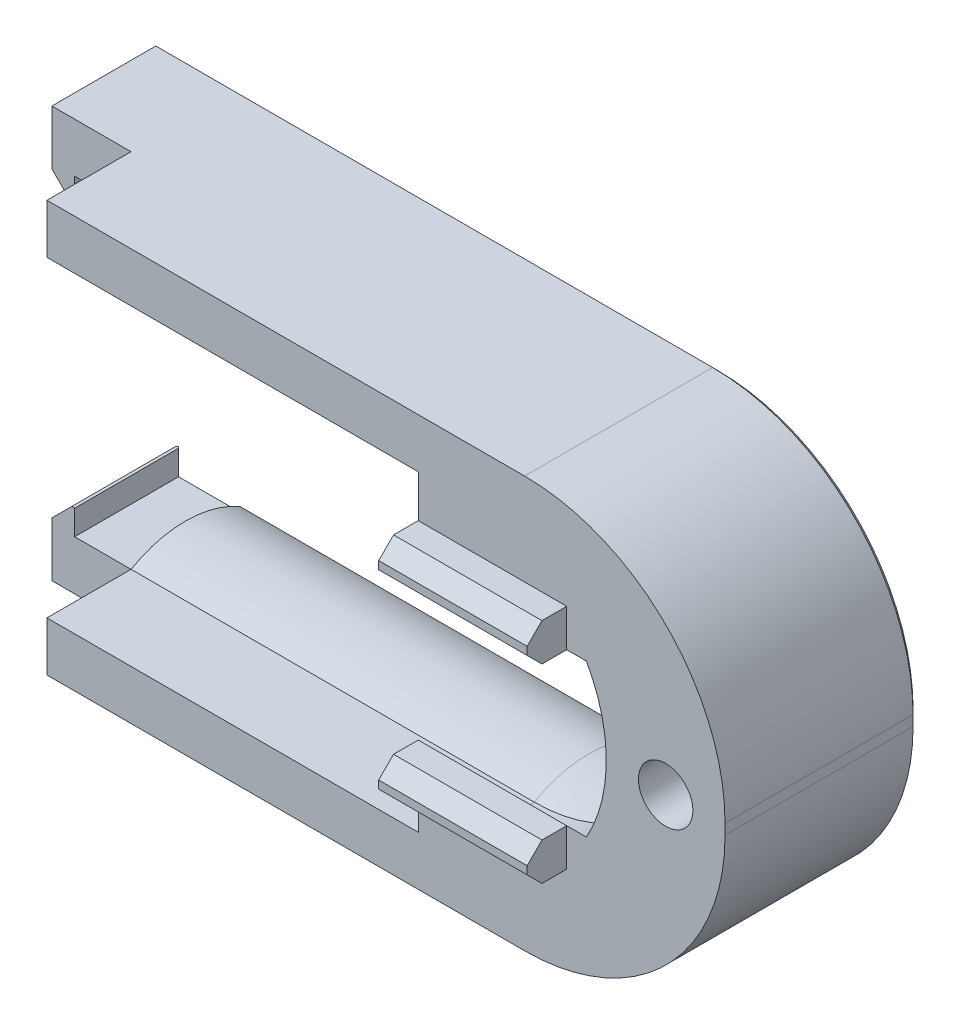
from build123d import *

# Parameters (mm, degrees)
BOSS_EXTRUDE1_DEPTH                                 = 14
BOSS_EXTRUDE1_DEPTH_BACK                            = 5.5
SKETCH3_R                                           = 2.750000000000022
BOSS_EXTRUDE2_DEPTH                                 = 7
CBORE_FOR_M5_HEX_SOCKET_HEAD_CAP_SCREW2_D           = 5.5
CBORE_FOR_M5_HEX_SOCKET_HEAD_CAP_SCREW2_CBORE_D     = 10
CBORE_FOR_M5_HEX_SOCKET_HEAD_CAP_SCREW2_CBORE_DEPTH = 5.4
SKETCH11_W                                          = 15
SKETCH11_H                                          = 3.8000000000000007
BOSS_EXTRUDE3_DEPTH                                 = 4
CHAMFER1_SIZE                                       = 1.5
CUT_EXTRUDE1_DEPTH                                  = 7
SKETCH13_W                                          = 15
SKETCH13_H                                          = 15.400000000000002
CUT_EXTRUDE2_DEPTH                                  = 7
CUT_EXTRUDE3_DEPTH                                  = 7
SKETCH15_W                                          = 11
SKETCH15_H                                          = 5
BOSS_EXTRUDE4_DEPTH                                 = 8
SKETCH16_W                                          = 2.3
SKETCH16_H                                          = 2.5
BOSS_EXTRUDE5_DEPTH                                 = 11
CHAMFER4_SIZE                                       = 2
CHAMFER3_SIZE                                       = 0.5
CHAMFER5_SIZE                                       = 7


# Some blends are built 0.0001 mm under size
with BuildPart() as part:
    # Sweep1: sweep along a path in Sketch1
    with BuildLine(Plane.XY) as sweep1_path:
        Line((0, 0), (40.75, 0))
        ThreePointArc((40.75, 0), (55.05, 14.3), (40.75, 28.6))
        Line((40.75, 28.6), (0, 28.599999999999998))
    # Sketch2 → Sweep1 (sweep)
    with BuildSketch(Plane(origin=(0, 0, 0), x_dir=(0, 0, -1), z_dir=(1, 0, 0))):
        with BuildLine():
            Line((-5.500000000000001, -1.4737205583711734), (5.499999999999999, -1.4737205583711734))
            ThreePointArc((5.499999999999999, -1.4737205583711734), (-1.9e-16, 1.78e-15), (-5.500000000000001, -1.4737205583711734))
        make_face()
    sweep(path=sweep1_path.line)

    # Sketch3 → Boss-Extrude1 (add, two sides: drawn at the far end of the back side and taken through both)
    with BuildSketch(Plane.XY.offset(-BOSS_EXTRUDE1_DEPTH_BACK)):
        with BuildLine():
            Line((-7e-17, 30.07372055837117), (0, 35.07372055837117))
            Line((0, 35.07372055837117), (48.273720558371174, 35.07372055837117))
            ThreePointArc((48.273720558371174, 35.07372055837117), (62.59263287739877, 29.14263287739876), (68.52372055837118, 14.82372055837117))
            Line((68.52372055837118, 14.82372055837117), (68.52372055837118, 13.776279441628832))
            ThreePointArc((68.52372055837118, 13.776279441628832), (62.59263287739876, -0.5426328773987557), (48.273720558371174, -6.473720558371171))
            Line((48.273720558371174, -6.473720558371171), (0, -6.473720558371174))
            Line((0, -6.473720558371174), (0, -1.4737205583711734))
            Line((0, -1.4737205583711734), (40.75, -1.4737205583711734))
            ThreePointArc((40.75, -1.4737205583711734), (56.523720558371174, 14.3), (40.75, 30.073720558371175))
            Line((40.75, 30.073720558371175), (-7e-17, 30.07372055837117))
        make_face()
        with Locations((62.52372055837116, 14.299999999999999)):
            Circle(SKETCH3_R, mode=Mode.SUBTRACT)
    extrude(amount=BOSS_EXTRUDE1_DEPTH + BOSS_EXTRUDE1_DEPTH_BACK)

    # Sketch10 → Boss-Extrude2 (add)
    with BuildSketch(Plane.XY.offset(14)):
        Polygon((33.523720558371174, 30.07372055837117), (56.523720558371174, 30.07372055837117), (56.52372055837118, -1.473720558371177), (33.523720558371174, -1.4737205583711734), align=None)
    extrude(amount=-BOSS_EXTRUDE2_DEPTH)

    # CBORE for M5 Hex Socket Head Cap Screw2 (through all)
    with Locations(Plane(origin=(0, 0, -5.5), x_dir=(-1, 0, 0), z_dir=(0, 0, -1))):
        with Locations((-62.523720558, 14.3)):
            CounterBoreHole(CBORE_FOR_M5_HEX_SOCKET_HEAD_CAP_SCREW2_D / 2, CBORE_FOR_M5_HEX_SOCKET_HEAD_CAP_SCREW2_CBORE_D / 2, CBORE_FOR_M5_HEX_SOCKET_HEAD_CAP_SCREW2_CBORE_DEPTH)

    # Sketch11 → Boss-Extrude3 (add)
    with BuildSketch(Plane.XY.offset(14)):
        with Locations((45.02372055837117, 23.9)):
            Rectangle(SKETCH11_W, SKETCH11_H)
        Polygon((37.52372055837117, 6.599999999999998), (52.52372055837117, 6.599999999999998), (52.523720558371174, 2.799999999999997), (37.52372055837117, 2.799999999999997), align=None)
    extrude(amount=BOSS_EXTRUDE3_DEPTH)

    # Chamfer1
    chamfer1_edges = [part.edges().sort_by_distance(p)[0] for p in [
        (45.02372055837117, 22, 18),
        (45.02372055837117, 25.8, 18),
        (45.02372055837117, 2.799999999999997, 18),
        (45.02372055837117, 6.599999999999998, 18),
    ]]
    chamfer(chamfer1_edges, length=CHAMFER1_SIZE)

    # Sketch12 → Cut-Extrude1 (cut)
    with BuildSketch(Plane.XY.offset(14)):
        Polygon((33.523720558371174, 30.07372055837117), (37.52372055837117, 30.07372055837117), (37.52372055837118, -1.4737205583711734), (33.523720558371174, -1.4737205583711734), align=None)
    extrude(amount=-CUT_EXTRUDE1_DEPTH, mode=Mode.SUBTRACT)

    # Sketch13 → Cut-Extrude2 (cut)
    with BuildSketch(Plane.XY.offset(14)):
        with Locations((45.02372055837117, 14.299999999999999)):
            Rectangle(SKETCH13_W, SKETCH13_H)
    extrude(amount=-CUT_EXTRUDE2_DEPTH, mode=Mode.SUBTRACT)

    # Sketch14 → Cut-Extrude3 (cut)
    with BuildSketch(Plane(origin=(0, 0, 7), x_dir=(-1, 0, 0), z_dir=(0, 0, -1))):
        with BuildLine():
            Line((-52.52372055837117, 22), (-54.51663576381613, 22))
            ThreePointArc((-54.51663576381613, 22), (-56.52372055837116, 14.3), (-54.516635763816126, 6.599999999999999))
            Line((-54.516635763816126, 6.599999999999999), (-52.52372055837117, 6.599999999999998))
            Line((-52.52372055837117, 6.599999999999998), (-52.52372055837117, 22))
        make_face()
    extrude(amount=-CUT_EXTRUDE3_DEPTH, mode=Mode.SUBTRACT)

    # Sketch15 → Boss-Extrude4 (add)
    with BuildSketch(Plane.ZY):
        with Locations((4.4e-16, 32.57372055837117)):
            Rectangle(SKETCH15_W, SKETCH15_H)
    boss_extrude4 = extrude(amount=BOSS_EXTRUDE4_DEPTH)

    # Sketch16 → Boss-Extrude5 (add)
    with BuildSketch(Plane(origin=(0, 0, -5.5), x_dir=(-1, 0, 0), z_dir=(0, 0, -1))):
        with Locations((6.850000000000001, 28.82372055837117)):
            Rectangle(SKETCH16_W, SKETCH16_H)
    boss_extrude5 = extrude(amount=-BOSS_EXTRUDE5_DEPTH)

    # Mirror1: Boss-Extrude4, Boss-Extrude5 across plane
    add(boss_extrude4.mirror(Plane(origin=(-6.1e-16, 14.299999999999997, 0), x_dir=(0, 0, 1), z_dir=(4e-17, -1, 0))))
    add(boss_extrude5.mirror(Plane(origin=(-6.1e-16, 14.299999999999997, 0), x_dir=(0, 0, 1), z_dir=(4e-17, -1, 0))))

    # Chamfer4
    chamfer4_edges = [part.edges().sort_by_distance(p)[0] for p in [
        (-8.000000000000002, 27.57372055837117, 0),
        (-8, 1.026279441628823, 0),
    ]]
    chamfer(chamfer4_edges, length=CHAMFER4_SIZE)

    # Chamfer3
    # the kernel refuses this chamfer: 0.5 mm, written as the material it takes off along each edge
    with BuildSketch(Plane(origin=(-8, 28.287879064388214, -5.5), x_dir=(0.9996219169112968, 0, -0.027495876610585647), z_dir=(-2.4e-16, 1, 0))) as chamfer3_piece_1:
        Polygon((CHAMFER3_SIZE * 0.999621916911, -CHAMFER3_SIZE * 0.0274958766106), (-CHAMFER3_SIZE * 0.0274958766106, -CHAMFER3_SIZE * 0.999621916911), (0, 0), align=None)
    extrude(amount=8.071682987965907, mode=Mode.SUBTRACT)
    with BuildSketch(Plane(origin=(48.273720558371174, 35.073720558371164, -5.5), x_dir=(0, -0.9996219169112968, -0.02749587661058574), z_dir=(-1, 1.3e-16, 0))) as chamfer3_piece_2:
        Polygon((CHAMFER3_SIZE * 0.999621916911, CHAMFER3_SIZE * 0.0274958766106), (-CHAMFER3_SIZE * 0.0274958766106, CHAMFER3_SIZE * 0.999621916911), (0, 0), align=None)
    extrude(amount=57.55956205235414, mode=Mode.SUBTRACT)
    with BuildSketch(Plane(origin=(48.273720558371195, 14.823720558371178, -5.5), x_dir=(-1.05e-15, 1, 0), z_dir=(-1, -1.05e-15, 0))) as chamfer3_piece_3:
        Polygon((20.249999999999986 - CHAMFER3_SIZE, 0), (20.249999999999986, -CHAMFER3_SIZE), (20.249999999999986, 0), align=None)
    revolve(axis=Axis((48.273720558371195, 14.823720558371178, -5.5), (0, 0, -1)), revolution_arc=90.00000000000009, mode=Mode.SUBTRACT)
    with BuildSketch(Plane(origin=(68.52372055837118, 14.82372055837117, -5.5), x_dir=(-0.9996219169112968, 0, -0.02749587661058574), z_dir=(0, -1, 0))) as chamfer3_piece_4:
        Polygon((CHAMFER3_SIZE * 0.999621916911, -CHAMFER3_SIZE * 0.0274958766106), (-CHAMFER3_SIZE * 0.0274958766106, -CHAMFER3_SIZE * 0.999621916911), (0, 0), align=None)
    extrude(amount=1.0474411167423376, mode=Mode.SUBTRACT)
    with BuildSketch(Plane(origin=(-2.56e-15, 30.07372055837117, -5.5), x_dir=(0, 0.9996219169112968, -0.02749587661058555), z_dir=(-1, -9e-17, 0))) as chamfer3_piece_5:
        Polygon((CHAMFER3_SIZE * 0.999621916911, -CHAMFER3_SIZE * 0.0274958766106), (-CHAMFER3_SIZE * 0.0274958766106, -CHAMFER3_SIZE * 0.999621916911), (0, 0), align=None)
    extrude(amount=5.699999999999999, mode=Mode.SUBTRACT)
    with BuildSketch(Plane(origin=(-5.700000000000003, 26.287879064388214, -5.5), x_dir=(-0.9996219169112968, 0, -0.027495876610585647), z_dir=(0, 1, 0))) as chamfer3_piece_6:
        Polygon((CHAMFER3_SIZE * 0.999621916911, CHAMFER3_SIZE * 0.0274958766106), (-CHAMFER3_SIZE * 0.0274958766106, CHAMFER3_SIZE * 0.999621916911), (0, 0), align=None)
    extrude(amount=3.785841493982957, mode=Mode.SUBTRACT)
    with BuildSketch(Plane(origin=(48.27372055837117, 13.776279441628848, -5.5), x_dir=(1, -7.9e-16, 0), z_dir=(7.9e-16, 1, 0))) as chamfer3_piece_7:
        Polygon((20.250000000000014 - CHAMFER3_SIZE, 0), (20.250000000000014, -CHAMFER3_SIZE), (20.250000000000014, 0), align=None)
    revolve(axis=Axis((48.27372055837117, 13.776279441628848, -5.5), (0, 0, -1)), revolution_arc=89.99999999999993, mode=Mode.SUBTRACT)
    with BuildSketch(Plane(origin=(-9.285841493982957, -6.473720558371173, -5.5), x_dir=(0, 0.9996219169112968, -0.027495876610585647), z_dir=(1, 1.6e-16, 0))) as chamfer3_piece_8:
        Polygon((CHAMFER3_SIZE * 0.999621916911, CHAMFER3_SIZE * 0.0274958766106), (-CHAMFER3_SIZE * 0.0274958766106, CHAMFER3_SIZE * 0.999621916911), (0, 0), align=None)
    extrude(amount=57.55956205235413, mode=Mode.SUBTRACT)
    with BuildSketch(Plane(origin=(-8, 0.312120935611782, -5.5), x_dir=(0.9996219169112968, 0, -0.027495876610585647), z_dir=(-2.4e-16, -1, 0))) as chamfer3_piece_9:
        Polygon((CHAMFER3_SIZE * 0.999621916911, CHAMFER3_SIZE * 0.0274958766106), (-CHAMFER3_SIZE * 0.0274958766106, CHAMFER3_SIZE * 0.999621916911), (0, 0), align=None)
    extrude(amount=8.071682987965918, mode=Mode.SUBTRACT)
    with BuildSketch(Plane(origin=(-1.22e-15, -1.473720558371177, -5.5), x_dir=(0, -0.9996219169112968, -0.027495876610585623), z_dir=(-1, 0, 0))) as chamfer3_piece_10:
        Polygon((CHAMFER3_SIZE * 0.999621916911, CHAMFER3_SIZE * 0.0274958766106), (-CHAMFER3_SIZE * 0.0274958766106, CHAMFER3_SIZE * 0.999621916911), (0, 0), align=None)
    extrude(amount=5.699999999999999, mode=Mode.SUBTRACT)
    with BuildSketch(Plane(origin=(-5.700000000000003, 2.312120935611784, -5.5), x_dir=(-0.9996219169112968, 0, -0.027495876610585647), z_dir=(9e-17, -1, 0))) as chamfer3_piece_11:
        Polygon((CHAMFER3_SIZE * 0.999621916911, -CHAMFER3_SIZE * 0.0274958766106), (-CHAMFER3_SIZE * 0.0274958766106, -CHAMFER3_SIZE * 0.999621916911), (0, 0), align=None)
    extrude(amount=3.7858414939829608, mode=Mode.SUBTRACT)
    with BuildSketch(Plane(origin=(-8.909227239926395, 30.482947798297563, -5.5), x_dir=(0.7068394360706736, 0.7068394360706736, -0.027495876610585765), z_dir=(0.7071067811865476, -0.7071067811865476, 0))) as chamfer3_piece_12:
        Polygon((CHAMFER3_SIZE * 0.999621916911, CHAMFER3_SIZE * 0.0274958766106), (-CHAMFER3_SIZE * 0.0274958766106, CHAMFER3_SIZE * 0.999621916911), (0, 0), align=None)
    extrude(amount=5.400110112712111, mode=Mode.SUBTRACT)
    with BuildSketch(Plane(origin=(-5.090772760073612, 1.9355066815552142, -5.5), x_dir=(0.7068394360706735, -0.7068394360706735, -0.02749587661058555), z_dir=(-0.7071067811865476, -0.7071067811865476, 0))) as chamfer3_piece_13:
        Polygon((CHAMFER3_SIZE * 0.999621916911, CHAMFER3_SIZE * 0.0274958766106), (-CHAMFER3_SIZE * 0.0274958766106, CHAMFER3_SIZE * 0.999621916911), (0, 0), align=None)
    extrude(amount=5.400110112712108, mode=Mode.SUBTRACT)
    with BuildSketch(Plane(origin=(62.523720558, 14.3, -5.5), x_dir=(-1, 0, 0), z_dir=(0, -1, 0))) as chamfer3_piece_14:
        Polygon((5 + CHAMFER3_SIZE, 0), (5, -CHAMFER3_SIZE), (5, 0), align=None)
    revolve(axis=Axis((62.523720558, 14.3, -5.5), (0, 0, -1)), mode=Mode.SUBTRACT)
    with BuildSketch(Plane(origin=(-5.700000000000003, 26.287879064388214, -5.5), x_dir=(-0.9996219169112968, 0, -0.027495876610585647), z_dir=(0, 1, 0))) as chamfer3_piece_15a_section:
        Polygon((CHAMFER3_SIZE * 0.999621916911, CHAMFER3_SIZE * 0.0274958766106), (-CHAMFER3_SIZE * 0.0274958766106, CHAMFER3_SIZE * 0.999621916911), (0, 0), align=None)
    chamfer3_piece_15a = extrude(amount=5.071682987965914, mode=Mode.PRIVATE)
    chamfer3_piece_15a = split(chamfer3_piece_15a, bisect_by=Plane(origin=(-5.86489681340297, 30.07372055837117, -5.335103186597029), z_dir=(-9e-17, 1, 0)), keep=Keep.TOP, mode=Mode.PRIVATE)
    with BuildSketch(Plane(origin=(-2.56e-15, 30.07372055837117, -5.5), x_dir=(0, 0.9996219169112968, -0.02749587661058555), z_dir=(-1, -9e-17, 0))) as chamfer3_piece_15b_section:
        Polygon((CHAMFER3_SIZE * 0.999621916911, -CHAMFER3_SIZE * 0.0274958766106), (-CHAMFER3_SIZE * 0.0274958766106, -CHAMFER3_SIZE * 0.999621916911), (0, 0), align=None)
    chamfer3_piece_15b = extrude(amount=6.985841493982957, mode=Mode.PRIVATE)
    chamfer3_piece_15b = split(chamfer3_piece_15b, bisect_by=Plane(origin=(-5.700000000000002, 30.238617371774144, -5.33510318659703), z_dir=(-1, 0, 0)), keep=Keep.TOP, mode=Mode.PRIVATE)
    chamfer3_piece_15 = chamfer3_piece_15a & chamfer3_piece_15b
    add(chamfer3_piece_15, mode=Mode.SUBTRACT)
    with BuildSketch(Plane(origin=(-1.22e-15, -1.473720558371177, -5.5), x_dir=(0, -0.9996219169112968, -0.027495876610585623), z_dir=(-1, 0, 0))) as chamfer3_piece_16a_section:
        Polygon((CHAMFER3_SIZE * 0.999621916911, CHAMFER3_SIZE * 0.0274958766106), (-CHAMFER3_SIZE * 0.0274958766106, CHAMFER3_SIZE * 0.999621916911), (0, 0), align=None)
    chamfer3_piece_16a = extrude(amount=6.9858414939829565, mode=Mode.PRIVATE)
    chamfer3_piece_16a = split(chamfer3_piece_16a, bisect_by=Plane(origin=(-5.7, -1.6386173717741457, -5.335103186597028), z_dir=(-1, -9e-17, 0)), keep=Keep.TOP, mode=Mode.PRIVATE)
    with BuildSketch(Plane(origin=(-5.700000000000003, 2.312120935611784, -5.5), x_dir=(-0.9996219169112968, 0, -0.027495876610585647), z_dir=(9e-17, -1, 0))) as chamfer3_piece_16b_section:
        Polygon((CHAMFER3_SIZE * 0.999621916911, -CHAMFER3_SIZE * 0.0274958766106), (-CHAMFER3_SIZE * 0.0274958766106, -CHAMFER3_SIZE * 0.999621916911), (0, 0), align=None)
    chamfer3_piece_16b = extrude(amount=5.0716829879659215, mode=Mode.PRIVATE)
    chamfer3_piece_16b = split(chamfer3_piece_16b, bisect_by=Plane(origin=(-5.864896813402971, -1.473720558371177, -5.33510318659703), z_dir=(0, -1, 0)), keep=Keep.TOP, mode=Mode.PRIVATE)
    chamfer3_piece_16 = chamfer3_piece_16a & chamfer3_piece_16b
    add(chamfer3_piece_16, mode=Mode.SUBTRACT)

    # Chamfer5
    chamfer5_edges = [part.edges().sort_by_distance(p)[0] for p in [
        (46.02017816109365, 6.599999999999998, 7),
        (37.52372055837118, 2.563139720814412, 7),
        (46.020178161093654, 22, 7),
        (37.52372055837117, 26.036860279185586, 7),
    ]]
    chamfer(chamfer5_edges, length=CHAMFER5_SIZE - 0.0001)  # a hair under: the kernel refuses the full size


solid = part.part
